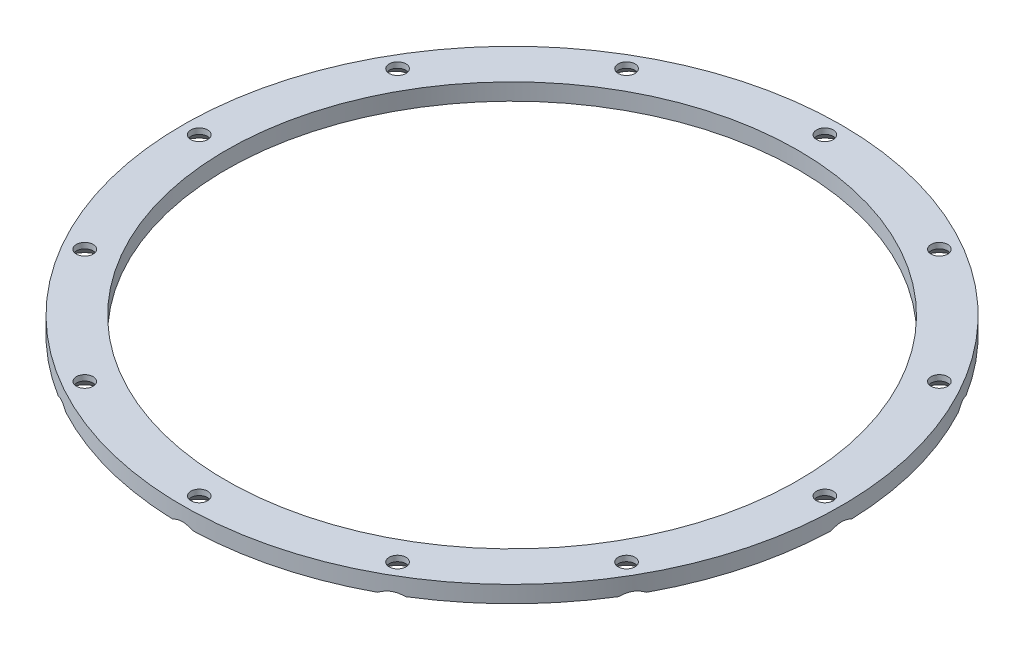
from build123d import *

# Parameters (mm, degrees)
SKETCH_2_R               = 1.5
CUT_EXTRUDE_1_DEPTH      = 10
PATTERN_CIRCULAR_1_COUNT = 12


with BuildPart() as part:
    # 草图1 → 旋转1 (revolve)
    with BuildSketch(Plane.XY, mode=Mode.PRIVATE) as revolve_1_sk:
        Polygon((-53, 0), (-59, 0), (-59, 3), (-51.2, 3), (-51.2, 0), align=None)
    revolve(revolve_1_sk.sketch.rotate(Axis((0, 0, 0), (0, 1, 0)), 270), axis=Axis((0, 0, 0), (0, 1, 0)))

    # 草图2 → 切除-拉伸1 (cut)
    with BuildSketch(Plane.XZ):
        with Locations(Location((0, 56, 0), (0, 0, 270))):
            Circle(SKETCH_2_R)
    cut_extrude_1 = extrude(amount=-CUT_EXTRUDE_1_DEPTH, mode=Mode.SUBTRACT)

    # 阵列(圆周)1: 切除-拉伸1 ×12 about axis
    pattern_circular_1_axis = Axis((0, 0, 0), (0, 1, 0))
    for i in range(1, PATTERN_CIRCULAR_1_COUNT):
        add(cut_extrude_1.rotate(pattern_circular_1_axis, i * 360 / PATTERN_CIRCULAR_1_COUNT), mode=Mode.SUBTRACT)

    # 圆角1: read off the stored shape, not the designer's step
    # 圆角1: loft between two sections, ruled curve by curve
    fillet_1_from = [
        Edge.make_three_point_arc((28, 2, 46.997422612), (29.5, 2, 48.497422612), (28, 2, 49.997422612)),
        Edge.make_three_point_arc((28, 2, 49.997422612), (26.5, 2, 48.497422612), (28, 2, 46.997422612)),
    ]
    fillet_1_to = [
        Edge.make_three_point_arc((28, 0, 44.997422612), (31.5, 0, 48.497422612), (28, 0, 51.997422612)),
        Edge.make_three_point_arc((28, 0, 51.997422612), (24.5, 0, 48.497422612), (28, 0, 44.997422612)),
    ]
    fillet_1 = Solid(Shell([*[Face.make_surface_from_curves(fillet_1_from[k], fillet_1_to[k]) for k in range(2)], Face(Wire(fillet_1_from)), Face(Wire(fillet_1_to))]))
    add(fillet_1, mode=Mode.SUBTRACT)

    # Fillet 1 2: loft between two sections, ruled curve by curve
    fillet_1_2_from = [
        Edge.make_three_point_arc((48.497422612, 2, 26.5), (49.997422612, 2, 28), (48.497422612, 2, 29.5)),
        Edge.make_three_point_arc((48.497422612, 2, 29.5), (46.997422612, 2, 28), (48.497422612, 2, 26.5)),
    ]
    fillet_1_2_to = [
        Edge.make_three_point_arc((48.497422612, 0, 24.5), (51.997422612, 0, 28), (48.497422612, 0, 31.5)),
        Edge.make_three_point_arc((48.497422612, 0, 31.5), (44.997422612, 0, 28), (48.497422612, 0, 24.5)),
    ]
    fillet_1_2 = Solid(Shell([*[Face.make_surface_from_curves(fillet_1_2_from[k], fillet_1_2_to[k]) for k in range(2)], Face(Wire(fillet_1_2_from)), Face(Wire(fillet_1_2_to))]))
    add(fillet_1_2, mode=Mode.SUBTRACT)

    # Fillet 1 3: loft between two sections, ruled curve by curve
    fillet_1_3_from = [
        Edge.make_three_point_arc((56, 2, -1.5), (57.5, 2, 0), (56, 2, 1.5)),
        Edge.make_three_point_arc((56, 2, 1.5), (54.5, 2, 0), (56, 2, -1.5)),
    ]
    fillet_1_3_to = [
        Edge.make_three_point_arc((56, 0, -3.5), (59.5, 0, 0), (56, 0, 3.5)),
        Edge.make_three_point_arc((56, 0, 3.5), (52.5, 0, 0), (56, 0, -3.5)),
    ]
    fillet_1_3 = Solid(Shell([*[Face.make_surface_from_curves(fillet_1_3_from[k], fillet_1_3_to[k]) for k in range(2)], Face(Wire(fillet_1_3_from)), Face(Wire(fillet_1_3_to))]))
    add(fillet_1_3, mode=Mode.SUBTRACT)

    # Fillet 1 4: loft between two sections, ruled curve by curve
    fillet_1_4_from = [
        Edge.make_three_point_arc((48.497422612, 2, -29.5), (49.997422612, 2, -28), (48.497422612, 2, -26.5)),
        Edge.make_three_point_arc((48.497422612, 2, -26.5), (46.997422612, 2, -28), (48.497422612, 2, -29.5)),
    ]
    fillet_1_4_to = [
        Edge.make_three_point_arc((48.497422612, 0, -31.5), (51.997422612, 0, -28), (48.497422612, 0, -24.5)),
        Edge.make_three_point_arc((48.497422612, 0, -24.5), (44.997422612, 0, -28), (48.497422612, 0, -31.5)),
    ]
    fillet_1_4 = Solid(Shell([*[Face.make_surface_from_curves(fillet_1_4_from[k], fillet_1_4_to[k]) for k in range(2)], Face(Wire(fillet_1_4_from)), Face(Wire(fillet_1_4_to))]))
    add(fillet_1_4, mode=Mode.SUBTRACT)

    # Fillet 1 5: loft between two sections, ruled curve by curve
    fillet_1_5_from = [
        Edge.make_three_point_arc((28, 2, -49.997422612), (29.5, 2, -48.497422612), (28, 2, -46.997422612)),
        Edge.make_three_point_arc((28, 2, -46.997422612), (26.5, 2, -48.497422612), (28, 2, -49.997422612)),
    ]
    fillet_1_5_to = [
        Edge.make_three_point_arc((28, 0, -51.997422612), (31.5, 0, -48.497422612), (28, 0, -44.997422612)),
        Edge.make_three_point_arc((28, 0, -44.997422612), (24.5, 0, -48.497422612), (28, 0, -51.997422612)),
    ]
    fillet_1_5 = Solid(Shell([*[Face.make_surface_from_curves(fillet_1_5_from[k], fillet_1_5_to[k]) for k in range(2)], Face(Wire(fillet_1_5_from)), Face(Wire(fillet_1_5_to))]))
    add(fillet_1_5, mode=Mode.SUBTRACT)

    # Fillet 1 6: loft between two sections, ruled curve by curve
    fillet_1_6_from = [
        Edge.make_three_point_arc((0, 2, -57.5), (1.5, 2, -56), (0, 2, -54.5)),
        Edge.make_three_point_arc((0, 2, -54.5), (-1.5, 2, -56), (0, 2, -57.5)),
    ]
    fillet_1_6_to = [
        Edge.make_three_point_arc((0, 0, -59.5), (3.5, 0, -56), (0, 0, -52.5)),
        Edge.make_three_point_arc((0, 0, -52.5), (-3.5, 0, -56), (0, 0, -59.5)),
    ]
    fillet_1_6 = Solid(Shell([*[Face.make_surface_from_curves(fillet_1_6_from[k], fillet_1_6_to[k]) for k in range(2)], Face(Wire(fillet_1_6_from)), Face(Wire(fillet_1_6_to))]))
    add(fillet_1_6, mode=Mode.SUBTRACT)

    # Fillet 1 7: loft between two sections, ruled curve by curve
    fillet_1_7_from = [
        Edge.make_three_point_arc((-28, 2, -49.997422612), (-26.5, 2, -48.497422612), (-28, 2, -46.997422612)),
        Edge.make_three_point_arc((-28, 2, -46.997422612), (-29.5, 2, -48.497422612), (-28, 2, -49.997422612)),
    ]
    fillet_1_7_to = [
        Edge.make_three_point_arc((-28, 0, -51.997422612), (-24.5, 0, -48.497422612), (-28, 0, -44.997422612)),
        Edge.make_three_point_arc((-28, 0, -44.997422612), (-31.5, 0, -48.497422612), (-28, 0, -51.997422612)),
    ]
    fillet_1_7 = Solid(Shell([*[Face.make_surface_from_curves(fillet_1_7_from[k], fillet_1_7_to[k]) for k in range(2)], Face(Wire(fillet_1_7_from)), Face(Wire(fillet_1_7_to))]))
    add(fillet_1_7, mode=Mode.SUBTRACT)

    # Fillet 1 8: loft between two sections, ruled curve by curve
    fillet_1_8_from = [
        Edge.make_three_point_arc((-48.497422612, 2, -29.5), (-46.997422612, 2, -28), (-48.497422612, 2, -26.5)),
        Edge.make_three_point_arc((-48.497422612, 2, -26.5), (-49.997422612, 2, -28), (-48.497422612, 2, -29.5)),
    ]
    fillet_1_8_to = [
        Edge.make_three_point_arc((-48.497422612, 0, -31.5), (-44.997422612, 0, -28), (-48.497422612, 0, -24.5)),
        Edge.make_three_point_arc((-48.497422612, 0, -24.5), (-51.997422612, 0, -28), (-48.497422612, 0, -31.5)),
    ]
    fillet_1_8 = Solid(Shell([*[Face.make_surface_from_curves(fillet_1_8_from[k], fillet_1_8_to[k]) for k in range(2)], Face(Wire(fillet_1_8_from)), Face(Wire(fillet_1_8_to))]))
    add(fillet_1_8, mode=Mode.SUBTRACT)

    # Fillet 1 9: loft between two sections, ruled curve by curve
    fillet_1_9_from = [
        Edge.make_three_point_arc((-56, 2, -1.5), (-54.5, 2, 0), (-56, 2, 1.5)),
        Edge.make_three_point_arc((-56, 2, 1.5), (-57.5, 2, 0), (-56, 2, -1.5)),
    ]
    fillet_1_9_to = [
        Edge.make_three_point_arc((-56, 0, -3.5), (-52.5, 0, 0), (-56, 0, 3.5)),
        Edge.make_three_point_arc((-56, 0, 3.5), (-59.5, 0, 0), (-56, 0, -3.5)),
    ]
    fillet_1_9 = Solid(Shell([*[Face.make_surface_from_curves(fillet_1_9_from[k], fillet_1_9_to[k]) for k in range(2)], Face(Wire(fillet_1_9_from)), Face(Wire(fillet_1_9_to))]))
    add(fillet_1_9, mode=Mode.SUBTRACT)

    # Fillet 1 10: loft between two sections, ruled curve by curve
    fillet_1_10_from = [
        Edge.make_three_point_arc((-48.497422612, 2, 26.5), (-46.997422612, 2, 28), (-48.497422612, 2, 29.5)),
        Edge.make_three_point_arc((-48.497422612, 2, 29.5), (-49.997422612, 2, 28), (-48.497422612, 2, 26.5)),
    ]
    fillet_1_10_to = [
        Edge.make_three_point_arc((-48.497422612, 0, 24.5), (-44.997422612, 0, 28), (-48.497422612, 0, 31.5)),
        Edge.make_three_point_arc((-48.497422612, 0, 31.5), (-51.997422612, 0, 28), (-48.497422612, 0, 24.5)),
    ]
    fillet_1_10 = Solid(Shell([*[Face.make_surface_from_curves(fillet_1_10_from[k], fillet_1_10_to[k]) for k in range(2)], Face(Wire(fillet_1_10_from)), Face(Wire(fillet_1_10_to))]))
    add(fillet_1_10, mode=Mode.SUBTRACT)

    # Fillet 1 11: loft between two sections, ruled curve by curve
    fillet_1_11_from = [
        Edge.make_three_point_arc((-28, 2, 46.997422612), (-26.5, 2, 48.497422612), (-28, 2, 49.997422612)),
        Edge.make_three_point_arc((-28, 2, 49.997422612), (-29.5, 2, 48.497422612), (-28, 2, 46.997422612)),
    ]
    fillet_1_11_to = [
        Edge.make_three_point_arc((-28, 0, 44.997422612), (-24.5, 0, 48.497422612), (-28, 0, 51.997422612)),
        Edge.make_three_point_arc((-28, 0, 51.997422612), (-31.5, 0, 48.497422612), (-28, 0, 44.997422612)),
    ]
    fillet_1_11 = Solid(Shell([*[Face.make_surface_from_curves(fillet_1_11_from[k], fillet_1_11_to[k]) for k in range(2)], Face(Wire(fillet_1_11_from)), Face(Wire(fillet_1_11_to))]))
    add(fillet_1_11, mode=Mode.SUBTRACT)

    # Fillet 1 12: loft between two sections, ruled curve by curve
    fillet_1_12_from = [
        Edge.make_three_point_arc((0, 2, 54.5), (1.5, 2, 56), (0, 2, 57.5)),
        Edge.make_three_point_arc((0, 2, 57.5), (-1.5, 2, 56), (0, 2, 54.5)),
    ]
    fillet_1_12_to = [
        Edge.make_three_point_arc((0, 0, 52.5), (3.5, 0, 56), (0, 0, 59.5)),
        Edge.make_three_point_arc((0, 0, 59.5), (-3.5, 0, 56), (0, 0, 52.5)),
    ]
    fillet_1_12 = Solid(Shell([*[Face.make_surface_from_curves(fillet_1_12_from[k], fillet_1_12_to[k]) for k in range(2)], Face(Wire(fillet_1_12_from)), Face(Wire(fillet_1_12_to))]))
    add(fillet_1_12, mode=Mode.SUBTRACT)


solid = part.part
